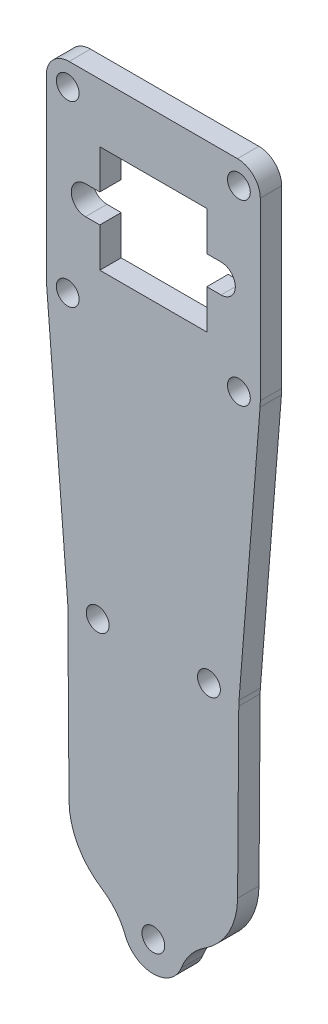
from build123d import *

# Parameters (mm, degrees)
SKETCH1_R           = 1.6
BOSS_EXTRUDE1_DEPTH = 3
FILLET1_R           = 10
FILLET2_R           = 2
FILLET3_R           = 2


# Some blends are built 0.0001 mm under size
with BuildPart() as part:
    # Sketch1 → Boss-Extrude1 (new body)
    with BuildSketch(Plane.XY):
        with BuildLine():
            Line((-15, 37.5), (-11.986741947, -0.333454454))
            Line((-11.986741947, -0.333454454), (-11.77, -31.11))
            ThreePointArc((-11.77, -31.11), (-7.007950772, -32.588761506), (-3.921159912, -36.504827214))
            ThreePointArc((-3.921159912, -36.504827214), (0, -39.2), (3.921159912, -36.504827214))
            ThreePointArc((3.921159912, -36.504827214), (7.007950772, -32.588761506), (11.77, -31.11))
            Line((11.77, -31.11), (11.986741947, -0.333454454))
            Line((11.986741947, -0.333454454), (15, 37.5))
            Line((15, 37.5), (15, 62.5))
            ThreePointArc((15, 62.5), (14.0627417, 64.7627417), (11.8, 65.7))
            Line((11.8, 65.7), (-11.8, 65.7))
            ThreePointArc((-11.8, 65.7), (-14.0627417, 64.7627417), (-15, 62.5))
            Line((-15, 62.5), (-15, 37.5))
        make_face()
        with Locations((7.8, 0)):
            Circle(SKETCH1_R, mode=Mode.SUBTRACT)
        with Locations((-12, 37.5)):
            Circle(SKETCH1_R, mode=Mode.SUBTRACT)
        with Locations((-12, 62.5)):
            Circle(SKETCH1_R, mode=Mode.SUBTRACT)
        Polygon((-7.5, 57.5), (7.5, 57.5), (7.5, 52), (11.5, 52), (11.5, 48), (7.5, 48), (7.5, 42.5), (-7.5, 42.5), (-7.5, 48), (-11.5, 48), (-11.5, 52), (-7.5, 52), align=None, mode=Mode.SUBTRACT)
        with Locations((12, 37.5)):
            Circle(SKETCH1_R, mode=Mode.SUBTRACT)
        with Locations((12, 62.5)):
            Circle(SKETCH1_R, mode=Mode.SUBTRACT)
        with Locations((-7.8, 0)):
            Circle(SKETCH1_R, mode=Mode.SUBTRACT)
        with Locations((0, -35)):
            Circle(SKETCH1_R, mode=Mode.SUBTRACT)
    extrude(amount=BOSS_EXTRUDE1_DEPTH)

    # Fillet1
    # the kernel refuses this fillet: 10 mm, written as the material it adds along each edge
    with BuildSketch(Plane(origin=(-11.986741947, -0.333454454, 0), x_dir=(-0.07939391755808242, 0.9968433206150205, 0), z_dir=(0, 0, 1)), Plane(origin=(11.986741947, -0.333454454, 0), x_dir=(-0.0070422644314045895, -0.9999752029483923, 0), z_dir=(0, 0, 1))) as fillet1_piece_1:
        with BuildLine():
            CenterArc((FILLET1_R * 0.0362334645201, FILLET1_R), FILLET1_R, 265.849766407, 4.150233593)
            Line((-FILLET1_R * 0.0361384500424, FILLET1_R * 0.00262228519856), (0, 0))
            Line((0, 0), (FILLET1_R * 0.0362334645201, 0))
        make_face()
    extrude(amount=3)
    # the kernel refuses this fillet: 10 mm, written as the material it takes off along each edge
    with BuildSketch(Plane(origin=(-11.77, -31.11, -17.521148691), x_dir=(-0.007042264431403126, 0.9999752029483922, 0), z_dir=(0, 0, 1))) as fillet1_2_piece_1:
        with BuildLine():
            CenterArc((7.008459476, -10), FILLET1_R, 90, 56.873561784)
            ThreePointArc((-1.366206899, -4.535115453), (-0.357121593, -2.365760003), (0, 0))
            Line((0, 0), (7.008459476, 0))
        make_face()
    extrude(amount=38.042297381, mode=Mode.SUBTRACT)
    with BuildSketch(Plane(origin=(-15, 37.5, -0.993992828), x_dir=(0, 1, 0), z_dir=(0, 0, 1)), Plane(origin=(15, 37.5, -0.993992828), x_dir=(-0.07939391755808864, -0.9968433206150199, 0), z_dir=(0, 0, 1))) as fillet1_2_piece_2:
        with BuildLine():
            CenterArc((FILLET1_R * 0.0397597131124, -FILLET1_R), FILLET1_R, 90, 4.553728958)
            Line((-FILLET1_R * 0.0396342044457, -FILLET1_R * 0.00315667938498), (0, 0))
            Line((0, 0), (FILLET1_R * 0.0397597131124, 0))
        make_face()
    extrude(amount=4.987985656, mode=Mode.SUBTRACT)
    with BuildSketch(Plane(origin=(11.77, -31.11, -17.521148691), x_dir=(-0.9595036182786473, -0.2816963019107352, 0), z_dir=(0, 0, 1))) as fillet1_2_piece_3:
        with BuildLine():
            CenterArc((7.553395586, -9.595036183), FILLET1_R, 106.361471425, 56.873561784)
            Line((-2.02156487, -6.710572234), (0, 0))
            ThreePointArc((0, 0), (2.368216284, -0.34045243), (4.736432567, 0))
        make_face()
    extrude(amount=38.042297381, mode=Mode.SUBTRACT)

    # Fillet2
    fillet2_edges = [part.edges().sort_by_distance(p)[0] for p in [
        (-11.5, 52, 1.5),
        (-11.5, 48, 1.5),
    ]]
    fillet(fillet2_edges, radius=FILLET2_R - 0.0001)  # a hair under: the kernel refuses the full size

    # Fillet3
    fillet3_edges = [part.edges().sort_by_distance(p)[0] for p in [
        (11.5, 48, 1.5),
        (11.5, 52, 1.5),
    ]]
    fillet(fillet3_edges, radius=FILLET3_R - 0.0001)  # a hair under: the kernel refuses the full size


solid = part.part
